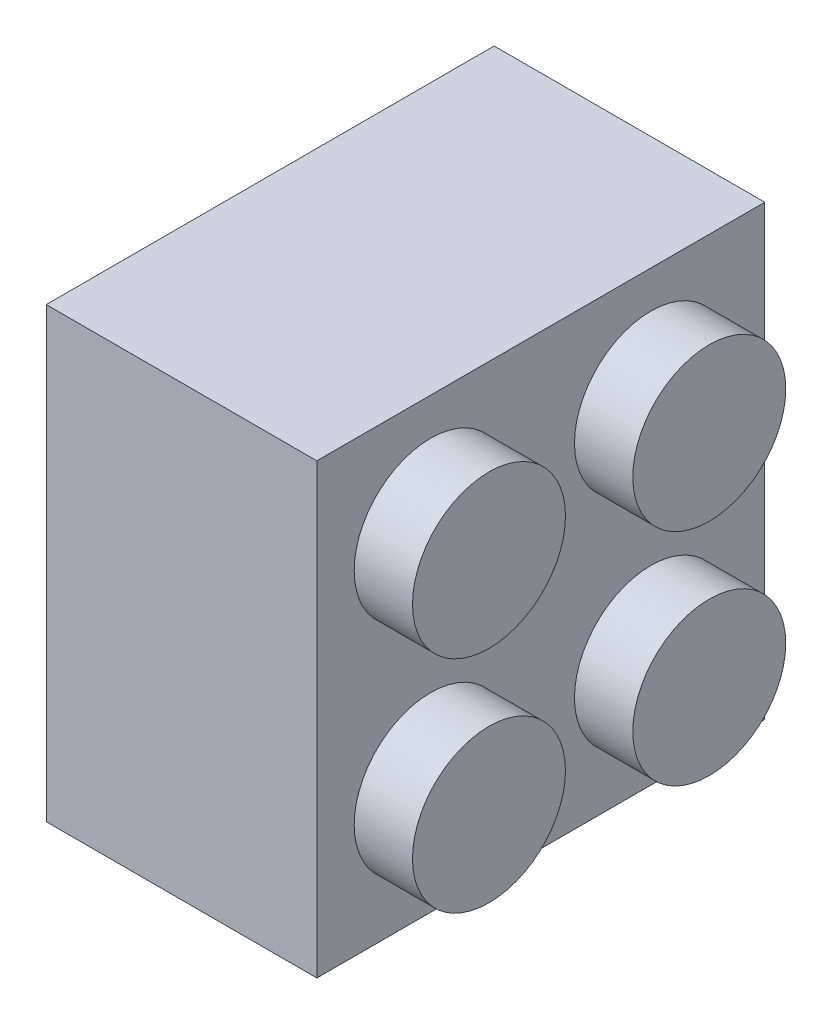
from build123d import *

# Parameters (mm, degrees)
ESQUISSE5_W        = 96
ESQUISSE5_H        = 96
ESQUISSE5_W_2      = 80
ESQUISSE5_H_2      = 80
BOSS_EXTRU_1_DEPTH = 48
ESQUISSE6_W        = 96
ESQUISSE6_H        = 96
BOSS_EXTRU_3_DEPTH = 10
ESQUISSE7_R        = 16.391900089
BOSS_EXTRU_4_DEPTH = 12.5
ESQUISSE8_R        = 18.5
ESQUISSE8_R_2      = 11.5
BOSS_EXTRU_5_DEPTH = 48
CHANFREIN2_SIZE2   = 48
CHANFREIN2_SIZE    = 4.199455849


with BuildPart() as part:
    # Esquisse5 → Boss.-Extru.1 (new body)
    with BuildSketch(Plane(origin=(0, 0, 0), x_dir=(0, 0, -1), z_dir=(1, 0, 0))):
        Rectangle(ESQUISSE5_W, ESQUISSE5_H)
        Rectangle(ESQUISSE5_W_2, ESQUISSE5_H_2, mode=Mode.SUBTRACT)
    extrude(amount=BOSS_EXTRU_1_DEPTH)

    # Esquisse6 → Boss.-Extru.3 (add)
    with BuildSketch(Plane(origin=(48, 0, 0), x_dir=(0, 0, -1), z_dir=(1, 0, 0))):
        Rectangle(ESQUISSE6_W, ESQUISSE6_H)
    extrude(amount=BOSS_EXTRU_3_DEPTH)

    # Esquisse7 → Boss.-Extru.4 (add)
    with BuildSketch(Plane(origin=(58, 0, 0), x_dir=(0, 0, -1), z_dir=(1, 0, 0))):
        with Locations((23.608099911, 23.608099911)):
            Circle(ESQUISSE7_R)
        with Locations((23.608099911, -23.608099911)):
            Circle(ESQUISSE7_R)
        with Locations((-23.608099911, -23.608099911)):
            Circle(ESQUISSE7_R)
        with Locations((-23.608099911, 23.608099911)):
            Circle(ESQUISSE7_R)
    extrude(amount=BOSS_EXTRU_4_DEPTH)

    # Esquisse8 → Boss.-Extru.5 (add)
    with BuildSketch(Plane.ZY):
        Circle(ESQUISSE8_R)
        Circle(ESQUISSE8_R_2, mode=Mode.SUBTRACT)
    extrude(amount=-BOSS_EXTRU_5_DEPTH)

    # Chanfrein2
    chanfrein2_edges = [part.edges().sort_by_distance(p)[0] for p in [
        (48, 0, -18.5),
    ]]
    chanfrein2_side = [part.faces().sort_by_distance(p)[0] for p in [
        (48, 0, -18.583989117),
    ]]
    chamfer(chanfrein2_edges, length=CHANFREIN2_SIZE - 0.0001, length2=CHANFREIN2_SIZE2 - 0.0001, reference=chanfrein2_side[0])  # a hair under: the kernel refuses the full size


solid = part.part
